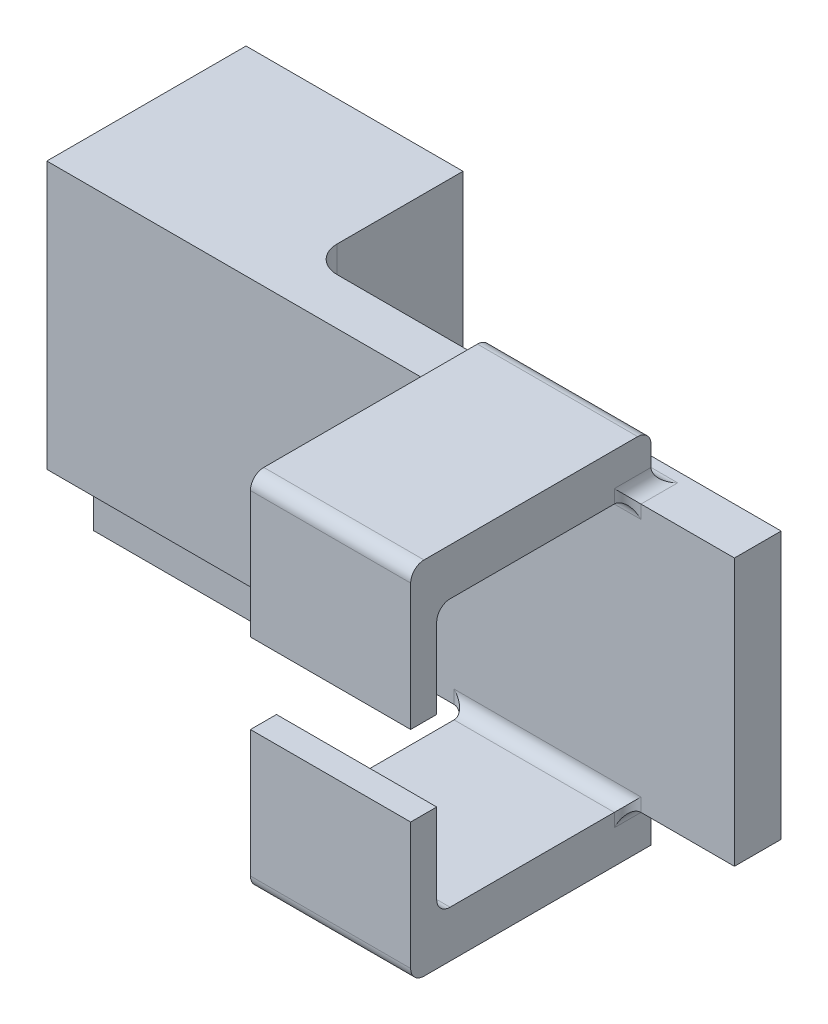
from build123d import *

# Parameters (mm, degrees)
SKETCH1_W           = 51.5
SKETCH1_H           = 20
BOSS_EXTRUDE1_DEPTH = 3.5
SKETCH2_W           = 12
SKETCH2_H           = 18
BOSS_EXTRUDE2_DEPTH = 3.5
FILLET1_R           = 1
FILLET2_R           = 1
SKETCH3_W           = 12
SKETCH3_H           = 18
BOSS_EXTRUDE3_DEPTH = 3.5
FILLET3_R           = 1
FILLET4_R           = 1
FILLET5_R           = 1
FILLET6_R           = 1
FILLET7_R           = 1
FILLET8_R           = 1
FILLET9_R           = 1
FILLET10_R          = 1
FILLET11_R          = 1
FILLET12_R          = 1
SKETCH4_W           = 12
SKETCH4_H           = 1.95
BOSS_EXTRUDE4_DEPTH = 7
SKETCH5_W           = 12
SKETCH5_H           = 1.95
BOSS_EXTRUDE5_DEPTH = 7
FILLET13_R          = 1
FILLET14_R          = 1
FILLET15_R          = 1
FILLET16_R          = 1
FILLET17_R          = 1
SKETCH8_W           = 16.25
SKETCH8_H           = 25.726511914
BOSS_EXTRUDE6_DEPTH = 11.42
FILLET21_R          = 2
FILLET22_R          = 2
FILLET23_R          = 2


with BuildPart() as part:
    # Sketch1 → Boss-Extrude1 (new body)
    with BuildSketch(Plane.XY):
        Rectangle(SKETCH1_W, SKETCH1_H)
    extrude(amount=BOSS_EXTRUDE1_DEPTH)

    # Sketch2 → Boss-Extrude2 (add)
    with BuildSketch(Plane(origin=(0, 10, 0), x_dir=(1, 0, 0), z_dir=(0, 1, 0))):
        with Locations((11.75, -10.75)):
            Rectangle(SKETCH2_W, SKETCH2_H)
    extrude(amount=BOSS_EXTRUDE2_DEPTH)

    # Fillet1
    fillet1_edges = [part.edges().sort_by_distance(p)[0] for p in [
        (11.75, 10, 1.75),
    ]]
    fillet(fillet1_edges, radius=FILLET1_R)

    # Fillet2
    fillet2_edges = [part.edges().sort_by_distance(p)[0] for p in [
        (11.75, 10, 3.5),
    ]]
    fillet(fillet2_edges, radius=FILLET2_R)

    # Sketch3 → Boss-Extrude3 (add)
    with BuildSketch(Plane(origin=(0, -10, 0), x_dir=(-1, 0, 0), z_dir=(0, -1, 0))):
        with Locations((-11.75, -10.75)):
            Rectangle(SKETCH3_W, SKETCH3_H)
    extrude(amount=BOSS_EXTRUDE3_DEPTH)

    # Fillet3
    fillet3_edges = [part.edges().sort_by_distance(p)[0] for p in [
        (11.75, -10, 1.75),
    ]]
    fillet(fillet3_edges, radius=FILLET3_R)

    # Fillet4
    fillet4_edges = [part.edges().sort_by_distance(p)[0] for p in [
        (11.75, -10, 3.5),
    ]]
    fillet(fillet4_edges, radius=FILLET4_R)

    # Fillet5
    fillet5_edges = [part.edges().sort_by_distance(p)[0] for p in [
        (17.75, 10, 2.125),
    ]]
    fillet(fillet5_edges, radius=FILLET5_R)

    # Fillet6
    fillet6_edges = [part.edges().sort_by_distance(p)[0] for p in [
        (5.75, 10, 2.125),
    ]]
    fillet(fillet6_edges, radius=FILLET6_R)

    # Fillet7
    fillet7_edges = [part.edges().sort_by_distance(p)[0] for p in [
        (17.75, 10, 3.5),
    ]]
    fillet(fillet7_edges, radius=FILLET7_R)

    # Fillet8
    fillet8_edges = [part.edges().sort_by_distance(p)[0] for p in [
        (5.75, 10, 3.5),
    ]]
    fillet(fillet8_edges, radius=FILLET8_R)

    # Fillet9
    fillet9_edges = [part.edges().sort_by_distance(p)[0] for p in [
        (5.75, -10, 2.125),
    ]]
    fillet(fillet9_edges, radius=FILLET9_R)

    # Fillet10
    fillet10_edges = [part.edges().sort_by_distance(p)[0] for p in [
        (5.75, -10, 3.5),
    ]]
    fillet(fillet10_edges, radius=FILLET10_R)

    # Fillet11
    fillet11_edges = [part.edges().sort_by_distance(p)[0] for p in [
        (17.75, -10, 2.125),
    ]]
    fillet(fillet11_edges, radius=FILLET11_R)

    # Fillet12
    fillet12_edges = [part.edges().sort_by_distance(p)[0] for p in [
        (17.75, -10, 3.5),
    ]]
    fillet(fillet12_edges, radius=FILLET12_R)

    # Sketch4 → Boss-Extrude4 (add)
    with BuildSketch(Plane(origin=(0, -10, 0), x_dir=(1, 0, 0), z_dir=(0, 1, 0))):
        with Locations((11.75, -18.775)):
            Rectangle(SKETCH4_W, SKETCH4_H)
    extrude(amount=BOSS_EXTRUDE4_DEPTH)

    # Sketch5 → Boss-Extrude5 (add)
    with BuildSketch(Plane(origin=(0, 10, 0), x_dir=(-1, 0, 0), z_dir=(0, -1, 0))):
        with Locations((-11.75, -18.775)):
            Rectangle(SKETCH5_W, SKETCH5_H)
    extrude(amount=BOSS_EXTRUDE5_DEPTH)

    # Fillet13
    fillet13_edges = [part.edges().sort_by_distance(p)[0] for p in [
        (11.75, 10, 17.8),
    ]]
    fillet(fillet13_edges, radius=FILLET13_R)

    # Fillet14
    fillet14_edges = [part.edges().sort_by_distance(p)[0] for p in [
        (11.75, 13.5, 19.75),
    ]]
    fillet(fillet14_edges, radius=FILLET14_R)

    # Fillet15
    fillet15_edges = [part.edges().sort_by_distance(p)[0] for p in [
        (11.75, 13.5, 1.75),
    ]]
    fillet(fillet15_edges, radius=FILLET15_R)

    # Fillet16
    fillet16_edges = [part.edges().sort_by_distance(p)[0] for p in [
        (11.75, -13.5, 19.75),
    ]]
    fillet(fillet16_edges, radius=FILLET16_R)

    # Fillet17
    fillet17_edges = [part.edges().sort_by_distance(p)[0] for p in [
        (11.75, -10, 17.8),
    ]]
    fillet(fillet17_edges, radius=FILLET17_R)

    # Sketch8 → Boss-Extrude6 (add)
    with BuildSketch(Plane(origin=(0, 0, 0), x_dir=(-1, 0, 0), z_dir=(0, 0, -1))):
        with Locations((17.625, -2.863255957)):
            Rectangle(SKETCH8_W, SKETCH8_H)
    extrude(amount=BOSS_EXTRUDE6_DEPTH)

    # Fillet21
    fillet21_edges = [part.edges().sort_by_distance(p)[0] for p in [
        (-9.5, 0, 0),
    ]]
    fillet(fillet21_edges, radius=FILLET21_R)

    # Fillet22
    fillet22_edges = [part.edges().sort_by_distance(p)[0] for p in [
        (-17.625, -10, 0),
    ]]
    fillet(fillet22_edges, radius=FILLET22_R)

    # Fillet23
    fillet23_edges = [part.edges().sort_by_distance(p)[0] for p in [
        (-9.5, -10, 0),
    ]]
    fillet(fillet23_edges, radius=FILLET23_R - 0.0001)  # a hair under: the kernel refuses the full size


solid = part.part
